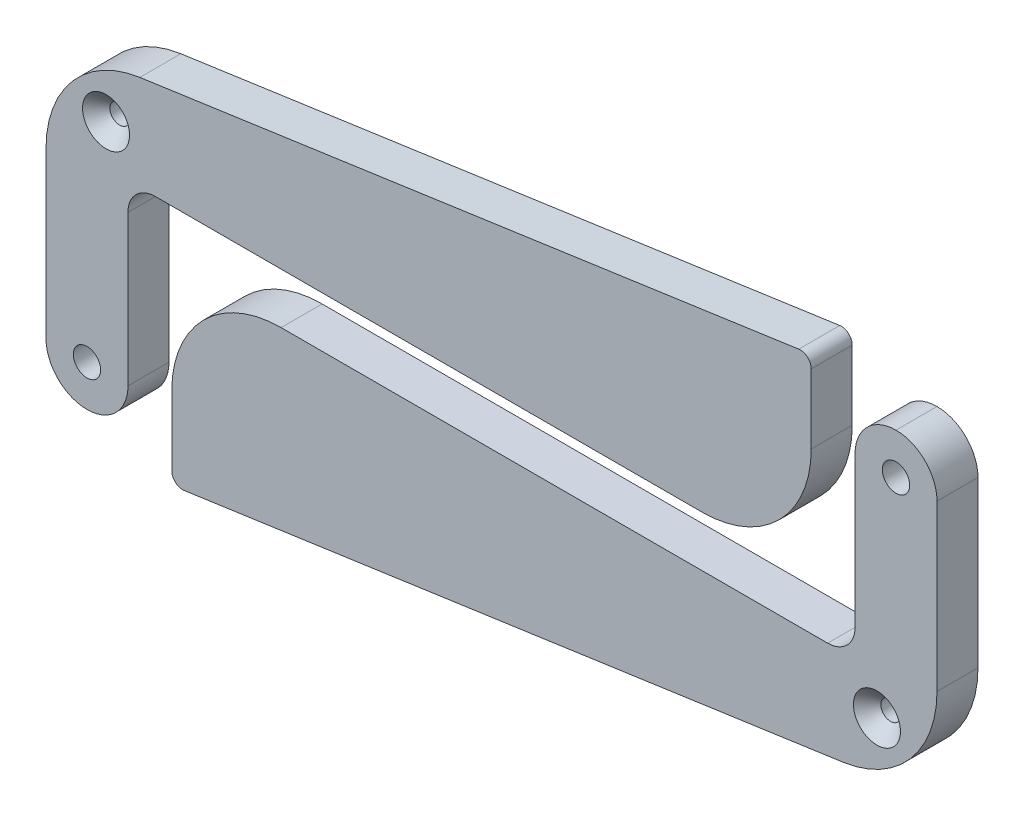
from build123d import *

# Parameters (mm, degrees)
BOSS_EXTRUDE1_DEPTH = 9.525
SKETCH4_W           = 19.05
SKETCH4_H           = 50.8
BOSS_EXTRUDE2_DEPTH = 9.525
FILLET1_R           = 2.54
SKETCH2_R           = 3.175
CUT_EXTRUDE1_DEPTH  = 186.15994606
FILLET2_R           = 25.4
FILLET3_R           = 25.4
FILLET4_R           = 6.35
FILLET5_R           = 9.525
SKETCH6_R           = 2.286
CUT_EXTRUDE3_DEPTH  = 186.15994606
CHAMFER1_SIZE       = 3.175
CIRPATTERN1_COUNT   = 2


with BuildPart() as part:
    # Sketch1 → Boss-Extrude1 (new body)
    with BuildSketch(Plane.XY):
        Polygon((0, 0), (177.8, 0), (177.8, 44.45), (0, 19.05), align=None)
    extrude(amount=BOSS_EXTRUDE1_DEPTH)

    # Sketch4 → Boss-Extrude2 (add)
    with BuildSketch(Plane.XY.offset(9.525)):
        with Locations((9.525, -25.4)):
            Rectangle(SKETCH4_W, SKETCH4_H)
    extrude(amount=-BOSS_EXTRUDE2_DEPTH)

    # Fillet1
    fillet1_edges = [part.edges().sort_by_distance(p)[0] for p in [
        (177.8, 44.45, 4.7625),
    ]]
    fillet(fillet1_edges, radius=FILLET1_R)

    # Sketch2 → Cut-Extrude1 (cut, through all)
    with BuildSketch(Plane.XY.offset(9.525)):
        with Locations((9.525, -41.275)):
            Circle(SKETCH2_R)
    extrude(amount=-CUT_EXTRUDE1_DEPTH, mode=Mode.SUBTRACT)

    # Fillet2
    fillet2_edges = [part.edges().sort_by_distance(p)[0] for p in [
        (177.8, 0, 4.7625),
    ]]
    fillet(fillet2_edges, radius=FILLET2_R)

    # Fillet3
    fillet3_edges = [part.edges().sort_by_distance(p)[0] for p in [
        (0, 19.05, 4.7625),
    ]]
    fillet(fillet3_edges, radius=FILLET3_R)

    # Fillet4
    fillet4_edges = [part.edges().sort_by_distance(p)[0] for p in [
        (19.05, 0, 4.7625),
    ]]
    fillet(fillet4_edges, radius=FILLET4_R)

    # Fillet5
    fillet5_edges = [part.edges().sort_by_distance(p)[0] for p in [
        (19.05, -50.8, 4.7625),
        (0, -50.8, 4.7625),
    ]]
    fillet(fillet5_edges, radius=FILLET5_R - 0.0001)  # a hair under: the kernel refuses the full size

    # Sketch6 → Cut-Extrude3 (cut, through all)
    with BuildSketch(Plane.XY.offset(9.525)):
        with Locations((13.952511732, 9.331690663)):
            Circle(SKETCH6_R)
    extrude(amount=-CUT_EXTRUDE3_DEPTH, mode=Mode.SUBTRACT)

    # Chamfer1
    chamfer1_edges = [part.edges().sort_by_distance(p)[0] for p in [
        (11.666511732, 9.331690663, 9.525),
    ]]
    chamfer(chamfer1_edges, length=CHAMFER1_SIZE)


with BuildPart() as cirpattern1_1:
    # CirPattern1: pattern copy
    add(part.part.rotate(Axis((103.510332135, -5.88426384, 0), (0, 0, 1)), 1 * 360 / CIRPATTERN1_COUNT))


solid = Compound([part.part, cirpattern1_1.part])
